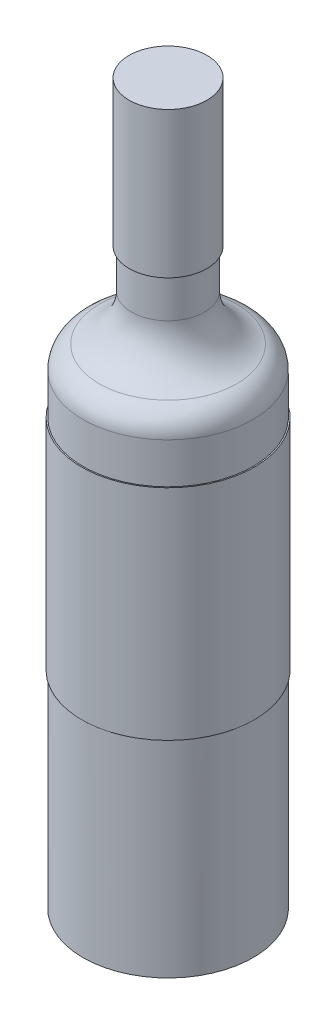
from build123d import *

# Parameters (mm, degrees)
SKETCH2_R           = 35
BOSS_EXTRUDE1_DEPTH = 200
SKETCH3_R           = 15
BOSS_EXTRUDE2_DEPTH = 95
FILLET1_R           = 20
FILLET2_R           = 10
BOSS_EXTRUDE3_START = 1
SKETCH4_R           = 16
BOSS_EXTRUDE3_DEPTH = 60
BOSS_EXTRUDE4_START = -85
SKETCH5_R           = 35.5
BOSS_EXTRUDE4_DEPTH = 90


with BuildPart() as part:
    # Sketch2 → Boss-Extrude1 (new body)
    with BuildSketch(Plane(origin=(0, 0, 0), x_dir=(1, 0, 0), z_dir=(0, 1, 0))):
        with Locations(Location((0, 0, 0), (0, 0, 270))):
            Circle(SKETCH2_R)
    extrude(amount=BOSS_EXTRUDE1_DEPTH)

    # Sketch3 → Boss-Extrude2 (add)
    with BuildSketch(Plane(origin=(0, 200, 0), x_dir=(1, 0, 0), z_dir=(0, 1, 0))):
        with Locations(Location((0, 0, 0), (0, 0, 270))):
            Circle(SKETCH3_R)
    extrude(amount=BOSS_EXTRUDE2_DEPTH)

    # Fillet1
    fillet1_edges = [part.edges().sort_by_distance(p)[0] for p in [
        (0, 200, -15),
    ]]
    fillet(fillet1_edges, radius=FILLET1_R - 0.0001)  # a hair under: the kernel refuses the full size

    # Fillet2
    fillet2_edges = [part.edges().sort_by_distance(p)[0] for p in [
        (0, 200, -35),
    ]]
    fillet(fillet2_edges, radius=FILLET2_R)

    # Sketch4 → Boss-Extrude3 (add)
    with BuildSketch(Plane(origin=(0, 295, 0), x_dir=(1, 0, 0), z_dir=(0, 1, 0)).offset(BOSS_EXTRUDE3_START)):
        with Locations(Location((0, 0, 0), (0, 0, 270))):
            Circle(SKETCH4_R)
    extrude(amount=-BOSS_EXTRUDE3_DEPTH)

    # Sketch5 → Boss-Extrude4 (add)
    with BuildSketch(Plane.XZ.offset(BOSS_EXTRUDE4_START)):
        with Locations(Location((0, 0, 0), (0, 0, 270))):
            Circle(SKETCH5_R)
    extrude(amount=-BOSS_EXTRUDE4_DEPTH)


solid = part.part
